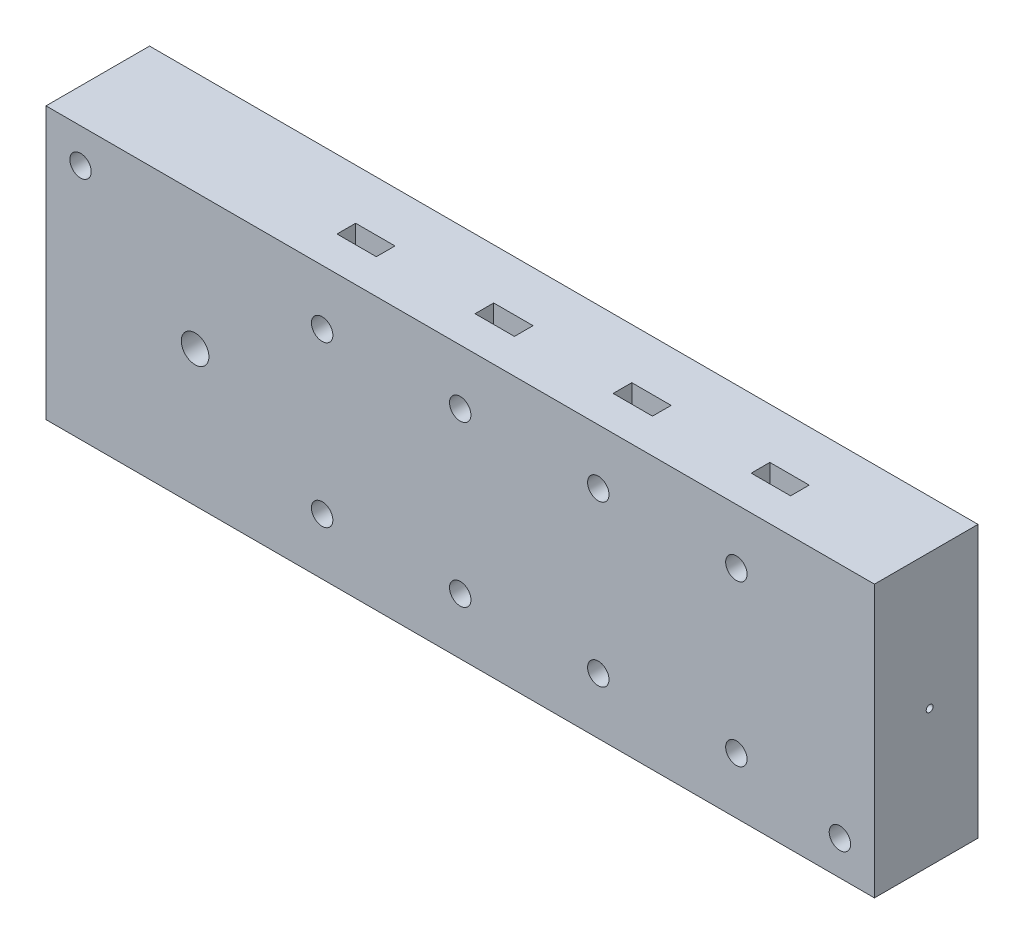
from build123d import *

# Parameters (mm, degrees)
SKIZZE2_W                        = 120
SKIZZE2_H                        = 39.364160046
AUFSATZ_LINEAR_AUSTRAGEN1_DEPTH  = 30
SKIZZE24_R                       = 1.55
SCHNITT_LINEAR_AUSTRAGEN4_DEPTH  = 130.805766806
SKIZZE46_R                       = 2.85
SCHNITT_LINEAR_AUSTRAGEN15_DEPTH = 10
SCHNITT_LINEAR_START             = -5
SCHNITT_LINEAR_AUSTRAGEN25_DEPTH = 2.7
LINEARES_MUSTER1_COUNT           = 4
LINEARES_MUSTER1_PITCH           = 20
SPIEGELN2_COPY_1_SKETCH_R        = 2.85
SPIEGELN2_COPY_1_DEPTH           = 10
SPIEGELN2_COPY_2_SKETCH_R        = 2.85
SPIEGELN2_COPY_2_DEPTH           = 10
SPIEGELN2_COPY_3_SKETCH_R        = 2.85
SPIEGELN2_COPY_3_DEPTH           = 10
SPIEGELN2_START                  = -5
SPIEGELN2_COPY_4_DEPTH           = 2.7
SPIEGELN2_COPY_5_DEPTH           = 2.7
SPIEGELN2_COPY_6_DEPTH           = 2.7
SKIZZE51_R                       = 1.55
SCHNITT_LINEAR_AUSTRAGEN26_DEPTH = 130.805766806
SKIZZE75_R                       = 0.75
SCHNITT_LINEAR_AUSTRAGEN28_DEPTH = 12
SKIZZE76_R                       = 2
SCHNITT_LINEAR_AUSTRAGEN29_DEPTH = 6
SKIZZE80_R                       = 0.5
SCHNITT_LINEAR_AUSTRAGEN34_DEPTH = 21.05
SCHNITT_LINEAR_START_2           = -7.5
SKIZZE81_R                       = 0.5
SCHNITT_LINEAR_AUSTRAGEN36_DEPTH = 5
FASE1_SIZE                       = 1
ABSPALTEN3_OUTLINE_W             = 120
ABSPALTEN3_OUTLINE_H             = 39.364160046
ABSPALTEN3_OUTLINE_R             = 1.55
ABSPALTEN3_DEPTH                 = 15


# Read off the part's stored shape, not the designer's step: Abspalten3
with BuildPart() as part:
    # Skizze2 → Aufsatz-Linear austragen1 (new body)
    with BuildSketch(Plane.XY):
        with Locations((60, 19.682080023)):
            Rectangle(SKIZZE2_W, SKIZZE2_H)
    extrude(amount=AUFSATZ_LINEAR_AUSTRAGEN1_DEPTH)

    # Skizze24 → Schnitt-Linear austragen4 (cut, through all)
    with BuildSketch(Plane.XY.offset(30)):
        with Locations((40, 31.364160046)):
            Circle(SKIZZE24_R)
        with Locations((60, 31.364160046)):
            Circle(SKIZZE24_R)
        with Locations((80, 31.364160046)):
            Circle(SKIZZE24_R)
        with Locations((100, 31.364160046)):
            Circle(SKIZZE24_R)
    schnitt_linear_austragen4 = extrude(amount=-SCHNITT_LINEAR_AUSTRAGEN4_DEPTH, mode=Mode.SUBTRACT)

    # Skizze46 → Schnitt-Linear austragen15 (cut)
    with BuildSketch(Plane(origin=(0, 0, 0), x_dir=(-1, 0, 0), z_dir=(0, 0, -1))):
        with Locations((-100, 31.364160046)):
            Circle(SKIZZE46_R)
    schnitt_linear_austragen15 = extrude(amount=-SCHNITT_LINEAR_AUSTRAGEN15_DEPTH, mode=Mode.SUBTRACT)

    # Skizze50 → Schnitt-Linear austragen25 (cut)
    with BuildSketch(Plane.XY.offset(30).offset(SCHNITT_LINEAR_START)):
        Polygon((97.15, 33.009608314), (97.15, 39.364160046), (102.85, 39.364160046), (102.85, 33.009608314), (102.85, 29.718711779), (100, 28.073263512), (97.15, 29.718711779), align=None)
    schnitt_linear_austragen25 = extrude(amount=-SCHNITT_LINEAR_AUSTRAGEN25_DEPTH, mode=Mode.SUBTRACT)

    # Lineares Muster1: Schnitt-Linear austragen15, Schnitt-Linear austragen25 ×4
    with Locations(*[(-i * LINEARES_MUSTER1_PITCH, 0, 0) for i in range(1, LINEARES_MUSTER1_COUNT)]):
        add(schnitt_linear_austragen15, mode=Mode.SUBTRACT)
        add(schnitt_linear_austragen25, mode=Mode.SUBTRACT)

    # Spiegeln2: Schnitt-Linear austragen15, Schnitt-Linear austragen25 across plane
    add(schnitt_linear_austragen15.mirror(Plane.ZX.offset(19.764160046)), mode=Mode.SUBTRACT)
    add(schnitt_linear_austragen25.mirror(Plane.ZX.offset(19.764160046)), mode=Mode.SUBTRACT)

    # Spiegeln2 copy 1 sketch → Spiegeln2 copy 1 (cut)
    with BuildSketch(Plane(origin=(-20, 39.528320093, 0), x_dir=(-1, 0, 0), z_dir=(0, 0, -1))):
        with Locations((-100, -31.364160046)):
            Circle(SPIEGELN2_COPY_1_SKETCH_R)
    extrude(amount=-SPIEGELN2_COPY_1_DEPTH, mode=Mode.SUBTRACT)

    # Spiegeln2 copy 2 sketch → Spiegeln2 copy 2 (cut)
    with BuildSketch(Plane(origin=(-40, 39.528320093, 0), x_dir=(-1, 0, 0), z_dir=(0, 0, -1))):
        with Locations((-100, -31.364160046)):
            Circle(SPIEGELN2_COPY_2_SKETCH_R)
    extrude(amount=-SPIEGELN2_COPY_2_DEPTH, mode=Mode.SUBTRACT)

    # Spiegeln2 copy 3 sketch → Spiegeln2 copy 3 (cut)
    with BuildSketch(Plane(origin=(-60, 39.528320093, 0), x_dir=(-1, 0, 0), z_dir=(0, 0, -1))):
        with Locations((-100, -31.364160046)):
            Circle(SPIEGELN2_COPY_3_SKETCH_R)
    extrude(amount=-SPIEGELN2_COPY_3_DEPTH, mode=Mode.SUBTRACT)

    # Spiegeln2 copy 4 sketch → Spiegeln2 copy 4 (cut)
    with BuildSketch(Plane(origin=(-20, 39.528320093, 30), x_dir=(1, 0, 0), z_dir=(0, 0, 1)).offset(SPIEGELN2_START)):
        Polygon((97.15, -33.009608314), (97.15, -39.364160046), (102.85, -39.364160046), (102.85, -33.009608314), (102.85, -29.718711779), (100, -28.073263512), (97.15, -29.718711779), align=None)
    extrude(amount=-SPIEGELN2_COPY_4_DEPTH, mode=Mode.SUBTRACT)

    # Spiegeln2 copy 5 sketch → Spiegeln2 copy 5 (cut)
    with BuildSketch(Plane(origin=(-40, 39.528320093, 30), x_dir=(1, 0, 0), z_dir=(0, 0, 1)).offset(SPIEGELN2_START)):
        Polygon((97.15, -33.009608314), (97.15, -39.364160046), (102.85, -39.364160046), (102.85, -33.009608314), (102.85, -29.718711779), (100, -28.073263512), (97.15, -29.718711779), align=None)
    extrude(amount=-SPIEGELN2_COPY_5_DEPTH, mode=Mode.SUBTRACT)

    # Spiegeln2 copy 6 sketch → Spiegeln2 copy 6 (cut)
    with BuildSketch(Plane(origin=(-60, 39.528320093, 30), x_dir=(1, 0, 0), z_dir=(0, 0, 1)).offset(SPIEGELN2_START)):
        Polygon((97.15, -33.009608314), (97.15, -39.364160046), (102.85, -39.364160046), (102.85, -33.009608314), (102.85, -29.718711779), (100, -28.073263512), (97.15, -29.718711779), align=None)
    extrude(amount=-SPIEGELN2_COPY_6_DEPTH, mode=Mode.SUBTRACT)

    # Spiegeln3: Schnitt-Linear austragen4 across plane
    add(schnitt_linear_austragen4.mirror(Plane.ZX.offset(19.764160046)), mode=Mode.SUBTRACT)

    # Skizze51 → Schnitt-Linear austragen26 (cut, through all)
    with BuildSketch(Plane.XY.offset(30)):
        with Locations((5, 34.364160046)):
            Circle(SKIZZE51_R)
        with Locations((115, 5)):
            Circle(SKIZZE51_R)
    extrude(amount=-SCHNITT_LINEAR_AUSTRAGEN26_DEPTH, mode=Mode.SUBTRACT)

    # Skizze73 → Schnitt-Rotation5 (revolve, cut)
    with BuildSketch(Plane.XY.offset(15)):
        Polygon((15, 19.764160046), (15, 23.814160046), (20, 23.814160046), (20, 24.814160046), (100, 23.232080023), (100, 22.232080023), (105, 22.232080023), (105, 19.682080023), align=None)
    revolve(axis=Axis((105, 19.682080023, 15), (-0.9999995841280241, 0.0009119998787298228, 0)), mode=Mode.SUBTRACT)

    # Skizze75 → Schnitt-Linear austragen28 (cut)
    with BuildSketch(Plane.XY.offset(30)):
        with Locations((21.598259807, 19.682080023)):
            Circle(SKIZZE75_R)
    extrude(amount=-SCHNITT_LINEAR_AUSTRAGEN28_DEPTH, mode=Mode.SUBTRACT)

    # Skizze76 → Schnitt-Linear austragen29 (cut)
    with BuildSketch(Plane.XY.offset(30)):
        with Locations((21.598259807, 19.682080023)):
            Circle(SKIZZE76_R)
    extrude(amount=-SCHNITT_LINEAR_AUSTRAGEN29_DEPTH, mode=Mode.SUBTRACT)

    # Skizze80 → Schnitt-Linear austragen34 (cut)
    with BuildSketch(Plane(origin=(120, 0, 0), x_dir=(0, 0, -1), z_dir=(1, 0, 0))):
        with Locations((-22.000416524, 19.763714623)):
            Circle(SKIZZE80_R)
    schnitt_linear_austragen34 = extrude(amount=-SCHNITT_LINEAR_AUSTRAGEN34_DEPTH, mode=Mode.SUBTRACT)

    # Skizze81 → Schnitt-Linear austragen36 (cut)
    with BuildSketch(Plane.XY.offset(30).offset(SCHNITT_LINEAR_START_2)):
        with Locations(Location((99, 19.682080023, 0), (0, 0, 7.034090001))):
            Circle(SKIZZE81_R)
    schnitt_linear_austragen36 = extrude(amount=-SCHNITT_LINEAR_AUSTRAGEN36_DEPTH, mode=Mode.SUBTRACT)

    # Spiegeln4: Schnitt-Linear austragen34, Schnitt-Linear austragen36 across plane
    add(schnitt_linear_austragen34.mirror(Plane.XY.offset(15)), mode=Mode.SUBTRACT)
    add(schnitt_linear_austragen36.mirror(Plane.XY.offset(15)), mode=Mode.SUBTRACT)

    # Fase1
    fase1_edges = [part.edges().sort_by_distance(p)[0] for p in [
        (20.848259807, 19.682080023, 24),
    ]]
    chamfer(fase1_edges, length=FASE1_SIZE)

    # Abspalten3 outline → Abspalten3 (cut)
    with BuildSketch(Plane.XY):
        with Locations((60, 19.682080023)):
            Rectangle(ABSPALTEN3_OUTLINE_W, ABSPALTEN3_OUTLINE_H)
        with Locations((115, 5)):
            Circle(ABSPALTEN3_OUTLINE_R, mode=Mode.SUBTRACT)
        with Locations((5, 34.364160046)):
            Circle(ABSPALTEN3_OUTLINE_R, mode=Mode.SUBTRACT)
        with Locations((40, 8.164160046)):
            Circle(ABSPALTEN3_OUTLINE_R, mode=Mode.SUBTRACT)
        with Locations((60, 8.164160046)):
            Circle(ABSPALTEN3_OUTLINE_R, mode=Mode.SUBTRACT)
        with Locations((80, 8.164160046)):
            Circle(ABSPALTEN3_OUTLINE_R, mode=Mode.SUBTRACT)
        with Locations((100, 8.164160046)):
            Circle(ABSPALTEN3_OUTLINE_R, mode=Mode.SUBTRACT)
        with Locations((40, 31.364160046)):
            Circle(ABSPALTEN3_OUTLINE_R, mode=Mode.SUBTRACT)
        with Locations((60, 31.364160046)):
            Circle(ABSPALTEN3_OUTLINE_R, mode=Mode.SUBTRACT)
        with Locations((80, 31.364160046)):
            Circle(ABSPALTEN3_OUTLINE_R, mode=Mode.SUBTRACT)
        with Locations((100, 31.364160046)):
            Circle(ABSPALTEN3_OUTLINE_R, mode=Mode.SUBTRACT)
    extrude(amount=ABSPALTEN3_DEPTH, mode=Mode.SUBTRACT)


solid = part.part
